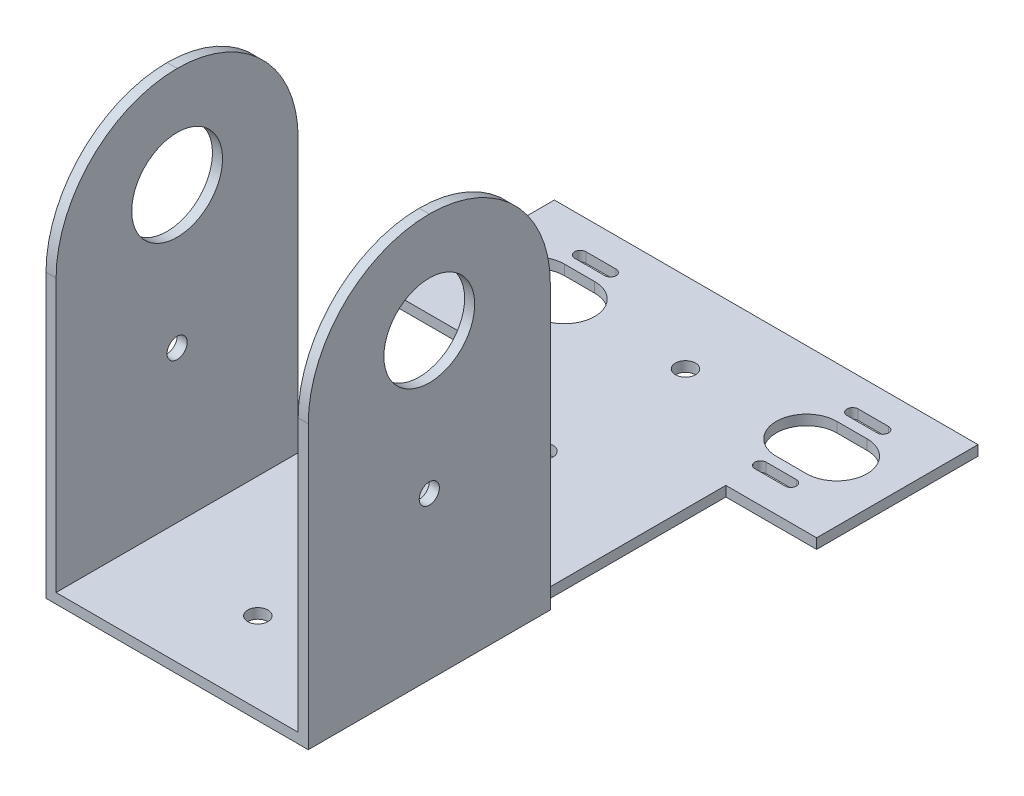
from build123d import *

# Parameters (mm, degrees)
SKETCH1_W           = 133.35
SKETCH1_H           = 50.8
BOSS_EXTRUDE1_DEPTH = 3.175
CUT_EXTRUDE1_DEPTH  = 3.175
SKETCH4_W           = 76.2
SKETCH4_H           = 3.175
BOSS_EXTRUDE2_DEPTH = 134.62
SKETCH5_W           = 3.175
SKETCH5_H           = 76.2
BOSS_EXTRUDE3_DEPTH = 127
FILLET1_R           = 38.1
SKETCH6_R           = 14.2875
SKETCH6_R_2         = 3.175
CUT_EXTRUDE3_DEPTH  = 232.059738812
SKETCH3_R           = 3.175
CUT_EXTRUDE2_DEPTH  = 214.036585238


with BuildPart() as part:
    # Sketch1 → Boss-Extrude1 (new body)
    with BuildSketch(Plane(origin=(0, 0, 0), x_dir=(1, 0, 0), z_dir=(0, 1, 0))):
        Rectangle(SKETCH1_W, SKETCH1_H)
    extrude(amount=BOSS_EXTRUDE1_DEPTH)

    # Sketch2 → Cut-Extrude1 (cut)
    with BuildSketch(Plane(origin=(0, 3.175, 0), x_dir=(1, 0, 0), z_dir=(0, 1, 0))):
        with BuildLine():
            Line((-47.625, -12.722), (-38.1, -12.722))
            ThreePointArc((-38.1, -12.722), (-36.322, -14.5), (-38.1, -16.278))
            Line((-38.1, -16.278), (-47.625, -16.278))
            ThreePointArc((-47.625, -16.278), (-49.403, -14.5), (-47.625, -12.722))
        make_face()
        with BuildLine():
            Line((-38.1, 12.722), (-47.625, 12.722))
            ThreePointArc((-47.625, 12.722), (-49.403, 14.5), (-47.625, 16.278))
            Line((-47.625, 16.278), (-38.1, 16.278))
            ThreePointArc((-38.1, 16.278), (-36.322, 14.5), (-38.1, 12.722))
        make_face()
        with BuildLine():
            Line((-38.1, -9.525), (-47.625, -9.525))
            ThreePointArc((-47.625, -9.525), (-57.15, 0), (-47.625, 9.525))
            Line((-47.625, 9.525), (-38.1, 9.525))
            ThreePointArc((-38.1, 9.525), (-28.575, 0), (-38.1, -9.525))
        make_face()
    cut_extrude1 = extrude(amount=-CUT_EXTRUDE1_DEPTH, mode=Mode.SUBTRACT)

    # Mirror1: Cut-Extrude1 across plane
    add(cut_extrude1.mirror(Plane(origin=(0, 0, 0), x_dir=(0, 0, 1), z_dir=(1, 0, 0))), mode=Mode.SUBTRACT)

    # Sketch4 → Boss-Extrude2 (add)
    with BuildSketch(Plane.XY.offset(25.4)):
        with Locations((0, 1.5875)):
            Rectangle(SKETCH4_W, SKETCH4_H)
    extrude(amount=BOSS_EXTRUDE2_DEPTH)

    # Sketch5 → Boss-Extrude3 (add)
    with BuildSketch(Plane.XZ):
        with Locations((39.6875, 121.92)):
            Rectangle(SKETCH5_W, SKETCH5_H)
        with Locations((-39.6875, 121.92)):
            Rectangle(SKETCH5_W, SKETCH5_H)
    extrude(amount=-BOSS_EXTRUDE3_DEPTH)

    # Fillet1
    fillet1_edges = [part.edges().sort_by_distance(p)[0] for p in [
        (39.6875, 127, 160.02),
        (-39.6875, 127, 160.02),
        (39.6875, 127, 83.82),
        (-39.6875, 127, 83.82),
    ]]
    fillet(fillet1_edges, radius=FILLET1_R - 0.0001)  # a hair under: the kernel refuses the full size

    # Sketch6 → Cut-Extrude3 (cut, through all)
    with BuildSketch(Plane.ZY.offset(41.275)):
        with Locations((121.92, 95.25)):
            Circle(SKETCH6_R)
        with Locations((121.92, 50.8)):
            Circle(SKETCH6_R_2)
    extrude(amount=-CUT_EXTRUDE3_DEPTH, mode=Mode.SUBTRACT)

    # Sketch3 → Cut-Extrude2 (cut, through all)
    with BuildSketch(Plane(origin=(0, 3.175, 0), x_dir=(1, 0, 0), z_dir=(0, 1, 0))):
        with Locations(Location((0, 0, 0), (0, 0, 270))):
            Circle(SKETCH3_R)
        with Locations(Location((0, -44.873333333, 0), (0, 0, 270))):
            Circle(SKETCH3_R)
        with Locations(Location((0, -89.746666667, 0), (0, 0, 270))):
            Circle(SKETCH3_R)
        with Locations(Location((0, -134.62, 0), (0, 0, 270))):
            Circle(SKETCH3_R)
    extrude(amount=-CUT_EXTRUDE2_DEPTH, mode=Mode.SUBTRACT)


solid = part.part
